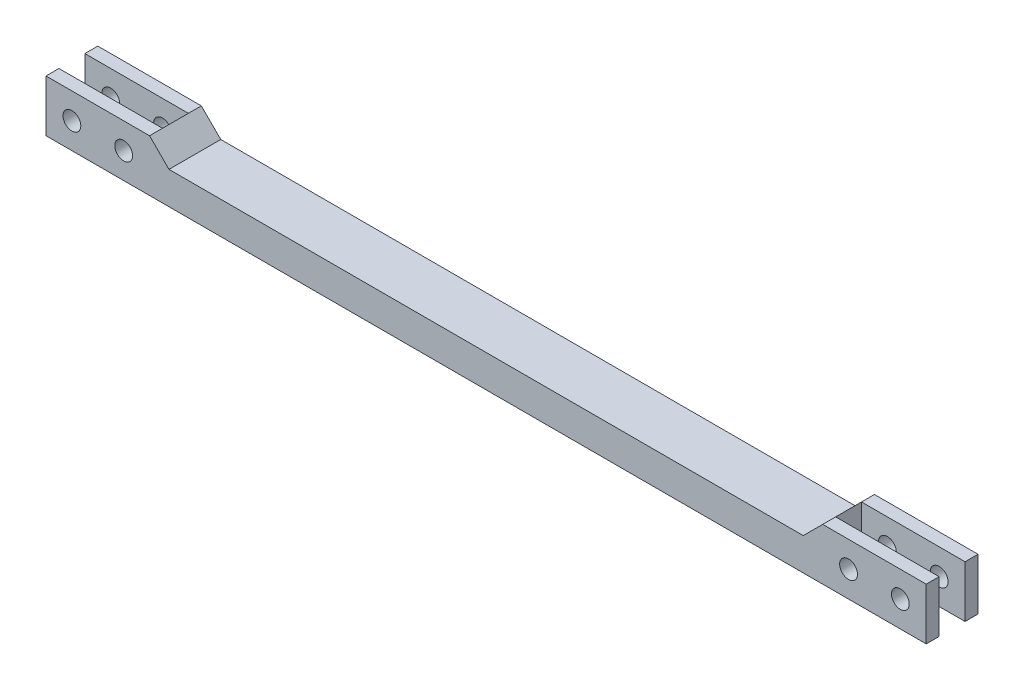
from build123d import *

# Parameters (mm, degrees)
BOSS_EXTRUDE1_DEPTH     = 6.35
CUT_EXTRUDE1_DEPTH      = 109.879819067
CUT_EXTRUDE1_DEPTH_BACK = 109.879819067
SKETCH2_R               = 2.1828125
CUT_EXTRUDE2_DEPTH      = 109.879819067
CUT_EXTRUDE2_DEPTH_BACK = 109.879819067


with BuildPart() as part:
    # Sketch1 → Boss-Extrude1 (new, symmetric)
    with BuildSketch(Plane(origin=(0, 0, 0), x_dir=(1, 0, 0), z_dir=(0, 1, 0))):
        Polygon((-107.95, 0), (107.95, 0), (107.95, 3.175), (82.55, 3.175), (82.55, 9.525), (107.95, 9.525), (107.95, 12.7), (-107.95, 12.7), (-107.95, 9.525), (-82.55, 9.525), (-82.55, 3.175), (-107.95, 3.175), align=None)
    extrude(amount=BOSS_EXTRUDE1_DEPTH, both=True)

    # Sketch2 → Cut-Extrude1 (cut, two sides: drawn at the far end of the back side and taken through both)
    with BuildSketch(Plane.XY.offset(-CUT_EXTRUDE1_DEPTH_BACK)):
        with Locations((-101.6, 0)):
            Circle(SKETCH2_R)
        with Locations((-88.9, 0)):
            Circle(SKETCH2_R)
        with Locations((101.6, 0)):
            Circle(SKETCH2_R)
        with Locations((88.9, 0)):
            Circle(SKETCH2_R)
    extrude(amount=CUT_EXTRUDE1_DEPTH + CUT_EXTRUDE1_DEPTH_BACK, mode=Mode.SUBTRACT)

    # Sketch3 → Cut-Extrude2 (cut, two sides: drawn at the far end of the back side and taken through both)
    with BuildSketch(Plane.XY.offset(-CUT_EXTRUDE2_DEPTH_BACK)):
        Polygon((-82.55, 6.35), (-77.7875, 1.5875), (77.7875, 1.5875), (82.55, 6.35), align=None)
    extrude(amount=CUT_EXTRUDE2_DEPTH + CUT_EXTRUDE2_DEPTH_BACK, mode=Mode.SUBTRACT)


solid = part.part
